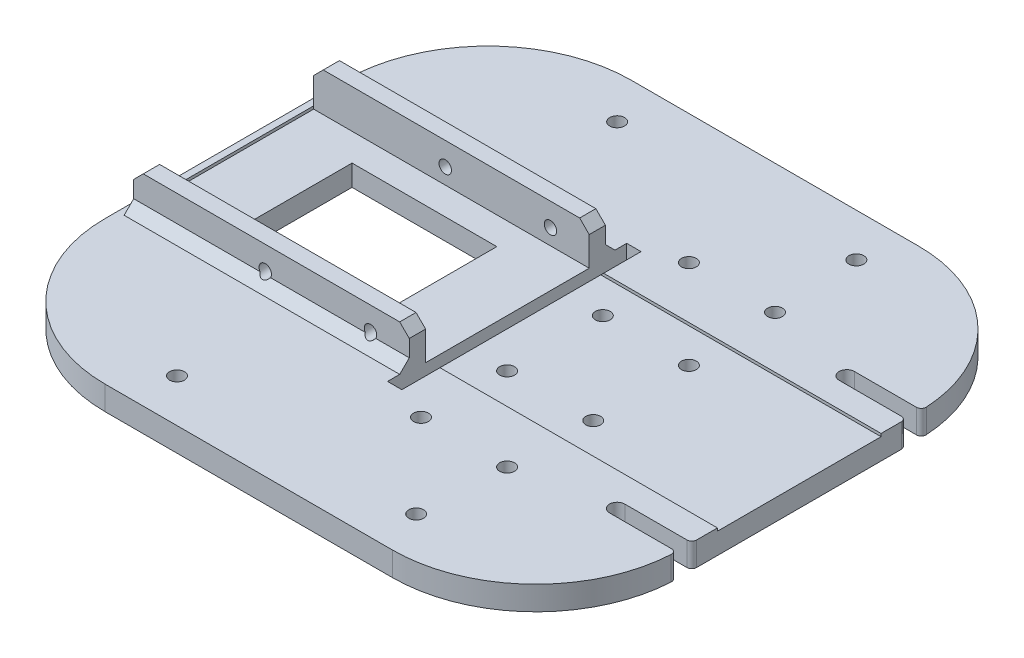
from build123d import *

# Parameters (mm, degrees)
SKETCH1_W               = 120
SKETCH1_H               = 110
SKETCH1_W_2             = 2
SKETCH1_H_2             = 50
BOSS_EXTRUDE1_DEPTH     = 5
SKETCH2_R               = 1.55
CUT_EXTRUDE1_DEPTH      = 82.547532152
CROQUIS1_W              = 57.6
CROQUIS1_H              = 41
SALIENTE_EXTRUIR1_DEPTH = 7.5
CROQUIS3_W              = 34.20218154
CROQUIS3_H              = 8.093357641
CORTAR_EXTRUIR1_DEPTH   = 132.328633588
CROQUIS4_R              = 1.3
CORTAR_EXTRUIR2_DEPTH   = 98.283361887
REDONDEO1_R             = 30
CHAFL_N1_SIZE           = 2
CHAFL_N2_SIZE           = 2
CHAFL_N3_SIZE           = 1
REDONDEO2_R             = 1
CROQUIS5_W              = 30.259884699
CROQUIS5_H              = 22.835005582
CORTAR_EXTRUIR3_DEPTH   = 82.79549155


with BuildPart() as part:
    # Sketch1 → Boss-Extrude1 (new body)
    with BuildSketch(Plane(origin=(0, 0, 0), x_dir=(1, 0, 0), z_dir=(0, 1, 0))):
        Rectangle(SKETCH1_W, SKETCH1_H)
        Rectangle(SKETCH1_W_2, SKETCH1_H_2, mode=Mode.SUBTRACT)
    extrude(amount=BOSS_EXTRUDE1_DEPTH)

    # Sketch2 → Cut-Extrude1 (cut, through all)
    with BuildSketch(Plane(origin=(0, 5, 0), x_dir=(1, 0, 0), z_dir=(0, 1, 0))):
        with Locations(Location((9, 28, 0), (0, 0, 270))):
            Circle(SKETCH2_R)
        with Locations(Location((9, 10, 0), (0, 0, 270))):
            Circle(SKETCH2_R)
        with Locations(Location((27, 10, 0), (0, 0, 270))):
            Circle(SKETCH2_R)
        with Locations(Location((27, 28, 0), (0, 0, 270))):
            Circle(SKETCH2_R)
        with Locations(Location((-24, 46, 0), (0, 0, 270))):
            Circle(SKETCH2_R)
        with Locations(Location((26, 46, 0), (0, 0, 270))):
            Circle(SKETCH2_R)
        with Locations(Location((27, -28, 0), (0, 0, 90))):
            Circle(SKETCH2_R)
        with Locations(Location((27, -10, 0), (0, 0, 90))):
            Circle(SKETCH2_R)
        with Locations(Location((9, -10, 0), (0, 0, 90))):
            Circle(SKETCH2_R)
        with Locations(Location((9, -28, 0), (0, 0, 90))):
            Circle(SKETCH2_R)
        with Locations(Location((26, -46, 0), (0, 0, 90))):
            Circle(SKETCH2_R)
        with Locations(Location((-24, -46, 0), (0, 0, 90))):
            Circle(SKETCH2_R)
        with BuildLine():
            Line((46, 22.4), (62.391060934, 22.4))
            Line((62.391060934, 22.4), (62.391060934, 25.6))
            Line((62.391060934, 25.6), (45.999999974, 25.6))
            ThreePointArc((45.999999974, 25.6), (44.4, 23.999999987), (46, 22.4))
        make_face()
        with BuildLine():
            Line((62.391060934, -25.6), (45.999999974, -25.6))
            ThreePointArc((45.999999974, -25.6), (44.4, -23.999999987), (46, -22.4))
            Line((46, -22.4), (62.391060934, -22.4))
            Line((62.391060934, -22.4), (62.391060934, -25.6))
        make_face()
    extrude(amount=-CUT_EXTRUDE1_DEPTH, mode=Mode.SUBTRACT)

    # Croquis1 → Saliente-Extruir1 (add)
    with BuildSketch(Plane(origin=(0, 5, 0), x_dir=(1, 0, 0), z_dir=(0, 1, 0))):
        with Locations((-29.8, 0.05)):
            Rectangle(CROQUIS1_W, CROQUIS1_H)
    extrude(amount=SALIENTE_EXTRUIR1_DEPTH)

    # Croquis3 → Cortar-Extruir1 (cut, through all)
    with BuildSketch(Plane.ZY.offset(58.6)):
        with Locations((-0.065699517, 8.453321179)):
            Rectangle(CROQUIS3_W, CROQUIS3_H)
    extrude(amount=-CORTAR_EXTRUIR1_DEPTH, mode=Mode.SUBTRACT)

    # Croquis4 → Cortar-Extruir2 (cut, through all)
    with BuildSketch(Plane(origin=(0, 0, -20.55), x_dir=(-1, 0, 0), z_dir=(0, 0, -1))):
        with Locations((31.1, 7.709263706)):
            Circle(CROQUIS4_R)
        with Locations((9.100000064, 7.707582737)):
            Circle(CROQUIS4_R)
    extrude(amount=-CORTAR_EXTRUIR2_DEPTH, mode=Mode.SUBTRACT)

    # Redondeo1
    # the kernel refuses this fillet: 30 mm, written as the material it takes off along each edge
    with BuildSketch(Plane(origin=(60, -74.9849985, -55), x_dir=(-1, 0, 0), z_dir=(0, 1, 0))) as redondeo1_piece_1:
        with BuildLine():
            CenterArc((29.9939994, 30), REDONDEO1_R, 181.145991998, 88.854008002)
            Line((0, 29.4), (-0.599879988, 29.388))
            ThreePointArc((-0.599879988, 29.388), (-0.6, 14.7), (-0.6, 0))
            Line((-0.6, 0), (0, -0.6))
            Line((0, -0.6), (29.9939994, -0.6))
            Line((29.9939994, -0.6), (29.9939994, 0))
        make_face()
    extrude(amount=154.969996999, mode=Mode.SUBTRACT)
    with BuildSketch(Plane(origin=(-60, -75, -55), x_dir=(1, 0, 0), z_dir=(0, 1, 0)), Plane(origin=(-60, -75, 55), x_dir=(0, 0, -1), z_dir=(0, 1, 0))) as redondeo1_piece_2:
        with BuildLine():
            CenterArc((REDONDEO1_R, -REDONDEO1_R), REDONDEO1_R, 90, 90)
            Line((0, -REDONDEO1_R), (-REDONDEO1_R * 0.02, -REDONDEO1_R))
            Line((-REDONDEO1_R * 0.02, -REDONDEO1_R), (-REDONDEO1_R * 0.02, REDONDEO1_R * 0.02))
            Line((-REDONDEO1_R * 0.02, REDONDEO1_R * 0.02), (REDONDEO1_R, REDONDEO1_R * 0.02))
            Line((REDONDEO1_R, REDONDEO1_R * 0.02), (REDONDEO1_R, 0))
        make_face()
    extrude(amount=155, mode=Mode.SUBTRACT)
    with BuildSketch(Plane(origin=(60, -74.9849985, 55), x_dir=(-1, 0, 0), z_dir=(0, 1, 0))) as redondeo1_piece_3:
        with BuildLine():
            CenterArc((29.9939994, -30), REDONDEO1_R, 90, 88.854008002)
            Line((0, -29.4), (-0.599879988, -29.388))
            ThreePointArc((-0.599879988, -29.388), (-0.6, -14.7), (-0.6, 0))
            Line((-0.6, 0), (0, 0.6))
            Line((0, 0.6), (29.9939994, 0.6))
            Line((29.9939994, 0.6), (29.9939994, 0))
        make_face()
    extrude(amount=154.969996999, mode=Mode.SUBTRACT)

    # Chaflán1
    # the kernel refuses this chamfer: 2 mm, written as the material it adds along each edge
    with BuildSketch(Plane(origin=(-1, 5, 20.45), x_dir=(0, -0.02749587661058651, 0.9996219169112968), z_dir=(-1, 0, 0))) as chafl_n1_piece_1_section:
        Polygon((CHAFL_N1_SIZE * 0.999621916911, CHAFL_N1_SIZE * 0.0274958766106), (-CHAFL_N1_SIZE * 0.0274958766106, CHAFL_N1_SIZE * 0.999621916911), (0, 0), align=None)
    chafl_n1_piece_1 = extrude(amount=57.6, mode=Mode.PRIVATE)
    chafl_n1_piece_1 = chafl_n1_piece_1 - Plane(origin=(-31.1, 7.709263706, 21.1121364), x_dir=(-1, 0, 0), z_dir=(0, 0, -1)) * Cylinder(1.3, 124, mode=Mode.PRIVATE)
    chafl_n1_piece_1 = chafl_n1_piece_1 - Plane(origin=(-9.100000064, 7.707582737, 21.1121364), x_dir=(-1, 0, 0), z_dir=(0, 0, -1)) * Cylinder(1.3, 124, mode=Mode.PRIVATE)
    add(chafl_n1_piece_1)
    with BuildSketch(Plane(origin=(-58.6, 5, -20.55), x_dir=(0, -0.02749587661058651, -0.9996219169112968), z_dir=(1, 0, 0))) as chafl_n1_piece_2_section:
        Polygon((CHAFL_N1_SIZE * 0.999621916911, CHAFL_N1_SIZE * 0.0274958766106), (-CHAFL_N1_SIZE * 0.0274958766106, CHAFL_N1_SIZE * 0.999621916911), (0, 0), align=None)
    chafl_n1_piece_2 = extrude(amount=57.6, mode=Mode.PRIVATE)
    chafl_n1_piece_2 = chafl_n1_piece_2 - Plane(origin=(-31.1, 7.709263706, -21.2121364), x_dir=(-1, 0, 0), z_dir=(0, 0, -1)) * Cylinder(1.3, 124, mode=Mode.PRIVATE)
    chafl_n1_piece_2 = chafl_n1_piece_2 - Plane(origin=(-9.100000064, 7.707582737, -21.2121364), x_dir=(-1, 0, 0), z_dir=(0, 0, -1)) * Cylinder(1.3, 124, mode=Mode.PRIVATE)
    add(chafl_n1_piece_2)
    # the kernel refuses this chamfer: 2 mm, written as the material it takes off along each edge
    with BuildSketch(Plane(origin=(-58.6, 12.5, -12.023424311), x_dir=(-0.027495876610585623, -0.9996219169112968, 0), z_dir=(0, 0, -1)), Plane(origin=(-1, 12.5, -25.693365976), x_dir=(0.02749587661058638, -0.9996219169112968, 0), z_dir=(0, 0, 1))) as chafl_n1_2_piece_1:
        Polygon((CHAFL_N1_SIZE * 0.999621916911, -CHAFL_N1_SIZE * 0.0274958766106), (-CHAFL_N1_SIZE * 0.0274958766106, -CHAFL_N1_SIZE * 0.999621916911), (0, 0), align=None)
    extrude(amount=13.669941665, mode=Mode.SUBTRACT)
    with BuildSketch(Plane(origin=(-1, 12.5, 11.892025277), x_dir=(0.02749587661058638, -0.9996219169112968, 0), z_dir=(0, 0, 1)), Plane(origin=(-58.6, 12.5, 25.593365976), x_dir=(-0.027495876610585623, -0.9996219169112968, 0), z_dir=(0, 0, -1))) as chafl_n1_2_piece_2:
        Polygon((CHAFL_N1_SIZE * 0.999621916911, -CHAFL_N1_SIZE * 0.0274958766106), (-CHAFL_N1_SIZE * 0.0274958766106, -CHAFL_N1_SIZE * 0.999621916911), (0, 0), align=None)
    extrude(amount=13.701340699, mode=Mode.SUBTRACT)

    # Chaflán2
    chafl_n2_edges = [part.edges().sort_by_distance(p)[0] for p in [
        (27, 0, 29.55),
        (27, 0, -29.55),
        (27, 0, -11.55),
        (9, 0, -11.55),
        (27, 0, 11.55),
        (9, 0, 11.55),
        (9, 0, 29.55),
        (9, 0, -29.55),
    ]]
    chamfer(chafl_n2_edges, length=CHAFL_N2_SIZE)

    # Chaflán3
    chafl_n3_edges = [part.edges().sort_by_distance(p)[0] for p in [
        (-1, 0, 0),
    ]]
    chamfer(chafl_n3_edges, length=CHAFL_N3_SIZE)
    chafl_n3_2_edges = [part.edges().sort_by_distance(p)[0] for p in [
        (0, 0, 25),
    ]]
    chamfer(chafl_n3_2_edges, length=CHAFL_N3_SIZE)
    chafl_n3_3_edges = [part.edges().sort_by_distance(p)[0] for p in [
        (0, 0, -25),
    ]]
    chamfer(chafl_n3_3_edges, length=CHAFL_N3_SIZE)
    chafl_n3_4_edges = [part.edges().sort_by_distance(p)[0] for p in [
        (1, 0, 0),
    ]]
    chamfer(chafl_n3_4_edges, length=CHAFL_N3_SIZE)
    chafl_n3_5_edges = [part.edges().sort_by_distance(p)[0] for p in [
        (1, 5, 21.017695626),
    ]]
    chamfer(chafl_n3_5_edges, length=CHAFL_N3_SIZE)

    # Redondeo2
    redondeo2_edges = [part.edges().sort_by_distance(p)[0] for p in [
        (60, 2.5, -22.4),
        (60, 2.5, -25.6),
        (60, 2.5, 25.6),
        (60, 2.5, 22.4),
    ]]
    fillet(redondeo2_edges, radius=REDONDEO2_R)

    # Croquis5 → Cortar-Extruir3 (cut, through all)
    with BuildSketch(Plane(origin=(0, 4.406642359, 0), x_dir=(1, 0, 0), z_dir=(0, 1, 0))):
        with Locations((-29.699516464, 0)):
            Rectangle(CROQUIS5_W, CROQUIS5_H)
    extrude(amount=-CORTAR_EXTRUIR3_DEPTH, mode=Mode.SUBTRACT)


solid = part.part
